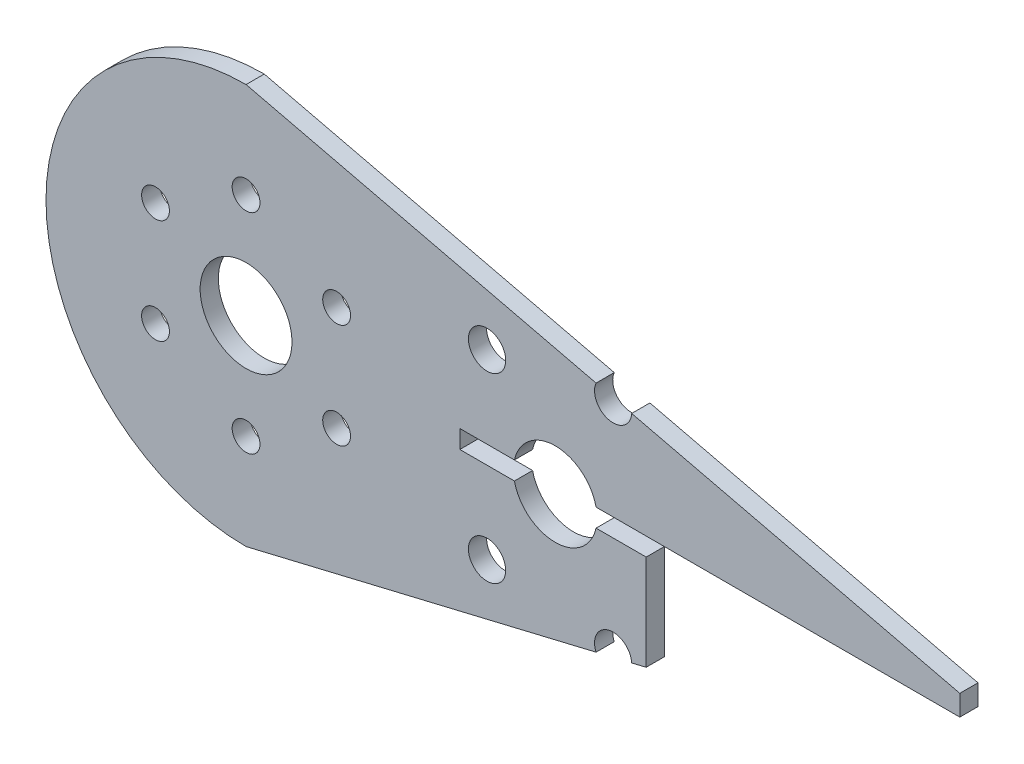
from build123d import *

# Parameters (mm, degrees)
SKETCH_1_R      = 5.05
SKETCH_1_R_2    = 1.53
SKETCH_1_R_3    = 2.05
EXTRUDE_1_DEPTH = 2


with BuildPart() as part:
    # 草图1 → 凸台-拉伸1 (new body)
    with BuildSketch(Plane.XY):
        with BuildLine():
            Line((-15.488984032, 1), (-9.488984032, 1))
            ThreePointArc((-9.488984032, 1), (-4.998995168, 4.6), (-0.509006304, 1))
            Line((-0.509006304, 1), (5.001004832, 1))
            Line((5.001004832, 1), (39.492739898, 1))
            Line((39.492739898, 1), (39.492739898, 3.269234909))
            Line((39.492739898, 3.269234909), (5.001004832, 11.501004832))
            Line((5.001004832, 11.501004832), (3.407723631, 11.881256049))
            ThreePointArc((3.407723631, 11.881256049), (0.892865212, 10.016888454), (-0.509006304, 12.816019685))
            Line((-0.509006304, 12.816019685), (-38.998995168, 22.002009663))
            ThreePointArc((-38.998995168, 22.002009663), (-61.001004832, 0), (-38.998995168, -22.002009663))
            Line((-38.998995168, -22.002009663), (-0.509006304, -12.816019685))
            ThreePointArc((-0.509006304, -12.816019685), (0.892865212, -10.016888454), (3.407723631, -11.881256049))
            Line((3.407723631, -11.881256049), (5.001004832, -11.501004832))
            Line((5.001004832, -11.501004832), (5.001004832, -1))
            Line((5.001004832, -1), (-0.509006304, -1))
            ThreePointArc((-0.509006304, -1), (-4.998995168, -4.6), (-9.488984032, -1))
            Line((-9.488984032, -1), (-15.488984032, -1))
            Line((-15.488984032, -1), (-15.488984032, 1))
        make_face()
        with Locations((-38.998995168, 0)):
            Circle(SKETCH_1_R, mode=Mode.SUBTRACT)
        with Locations((-38.998995168, -11.5)):
            Circle(SKETCH_1_R_2, mode=Mode.SUBTRACT)
        with Locations((-12.498995168, -10)):
            Circle(SKETCH_1_R_3, mode=Mode.SUBTRACT)
        with Locations((-48.958287312, -5.75)):
            Circle(SKETCH_1_R_2, mode=Mode.SUBTRACT)
        with Locations((-12.498995168, 10)):
            Circle(SKETCH_1_R_3, mode=Mode.SUBTRACT)
        with Locations((-48.958287312, 5.75)):
            Circle(SKETCH_1_R_2, mode=Mode.SUBTRACT)
        with Locations((-38.998995168, 11.5)):
            Circle(SKETCH_1_R_2, mode=Mode.SUBTRACT)
        with Locations((-29.039703025, 5.75)):
            Circle(SKETCH_1_R_2, mode=Mode.SUBTRACT)
        with Locations((-29.039703025, -5.75)):
            Circle(SKETCH_1_R_2, mode=Mode.SUBTRACT)
    extrude(amount=EXTRUDE_1_DEPTH)


solid = part.part
